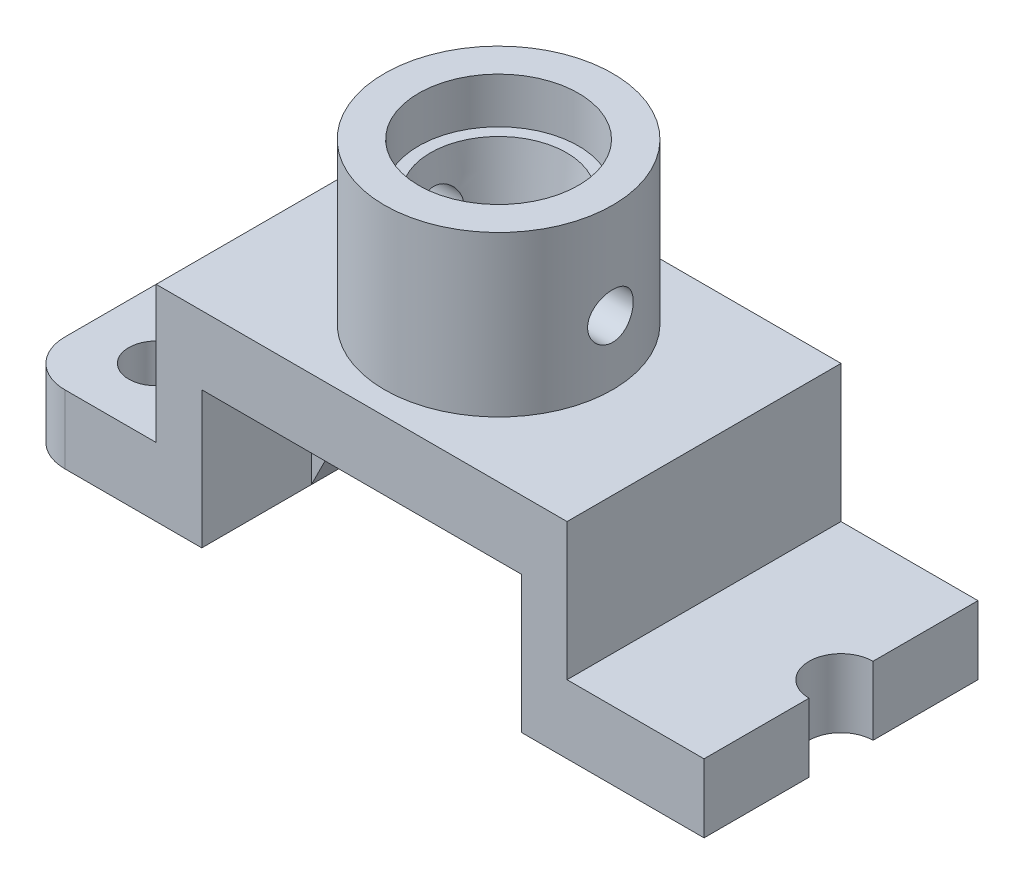
from build123d import *

# Parameters (mm, degrees)
SKETCH1_R           = 25
BOSS_EXTRUDE1_DEPTH = 35
SKETCH2_R           = 17.5
CUT_EXTRUDE1_DEPTH  = 10
SKETCH7_W           = 90
SKETCH7_H           = 60
BOSS_EXTRUDE3_DEPTH = 15
SKETCH8_R           = 10
CUT_EXTRUDE4_DEPTH  = 40
CUT_EXTRUDE4_DRAFT  = 7
SKETCH9_W           = 10
SKETCH9_H           = 60
BOSS_EXTRUDE4_DEPTH = 30
SKETCH11_R          = 5
CUT_EXTRUDE5_DEPTH  = 35
SKETCH12_W          = 60
SKETCH12_H          = 15
BOSS_EXTRUDE5_DEPTH = 30
RIB1_START          = -6
RIB1_DEPTH          = 12
SKETCH16_R          = 6
CUT_EXTRUDE6_DEPTH  = 30
FILLET1_R           = 10
SKETCH17_R          = 7
CUT_EXTRUDE7_DEPTH  = 30


# Read off the part's stored shape, not the designer's step: Rib1
with BuildPart() as part:
    # Sketch1 → Boss-Extrude1 (new body)
    with BuildSketch(Plane(origin=(0, 0, 0), x_dir=(1, 0, 0), z_dir=(0, 1, 0))):
        with Locations(Location((0, 0, 0), (0, 0, 270))):
            Circle(SKETCH1_R)
    extrude(amount=BOSS_EXTRUDE1_DEPTH)

    # Sketch2 → Cut-Extrude1 (cut)
    with BuildSketch(Plane(origin=(0, 35, 0), x_dir=(1, 0, 0), z_dir=(0, 1, 0))):
        with Locations(Location((0, 0, 0), (0, 0, 270))):
            Circle(SKETCH2_R)
    extrude(amount=-CUT_EXTRUDE1_DEPTH, mode=Mode.SUBTRACT)

    # Sketch7 → Boss-Extrude3 (add)
    with BuildSketch(Plane.XZ):
        Rectangle(SKETCH7_W, SKETCH7_H)
    extrude(amount=BOSS_EXTRUDE3_DEPTH)


with BuildPart() as cut_extrude4_tool:
    # Sketch8 → Cut-Extrude4 (with draft: the straight prism first)
    with BuildSketch(Plane.XZ.offset(15)):
        Circle(SKETCH8_R)
    extrude(amount=-CUT_EXTRUDE4_DEPTH)
    # Cut-Extrude4: the draft: its side faces are tilted about the plane it starts from
    cut_extrude4_sides = [cut_extrude4_tool.faces().sort_by_distance(p)[0] for p in [
        (-10, 5, 0),
    ]]
    draft(cut_extrude4_sides, Plane.XZ.offset(15), CUT_EXTRUDE4_DRAFT)


with BuildPart() as part_1:
    add(part.part)

    # Cut-Extrude4: cut by cut_extrude4_tool
    add(cut_extrude4_tool.part, mode=Mode.SUBTRACT)

    # Sketch9 → Boss-Extrude4 (add)
    with BuildSketch(Plane.XZ.offset(15)):
        with Locations((-40, 0)):
            Rectangle(SKETCH9_W, SKETCH9_H)
        with Locations((40, 0)):
            Rectangle(SKETCH9_W, SKETCH9_H)
    extrude(amount=BOSS_EXTRUDE4_DEPTH)

    # Sketch11 → Cut-Extrude5 (cut, symmetric)
    with BuildSketch(Plane(origin=(0, 0, 0), x_dir=(0, 0, -1), z_dir=(1, 0, 0))):
        with Locations((0, 14)):
            Circle(SKETCH11_R)
    extrude(amount=CUT_EXTRUDE5_DEPTH, both=True, mode=Mode.SUBTRACT)

    # Sketch12 → Boss-Extrude5 (add)
    with BuildSketch(Plane(origin=(45, 0, 0), x_dir=(0, 0, -1), z_dir=(1, 0, 0))):
        with Locations((0, -37.5)):
            Rectangle(SKETCH12_W, SKETCH12_H)
    boss_extrude5 = extrude(amount=BOSS_EXTRUDE5_DEPTH)

    # Mirror1: Boss-Extrude5 across plane
    add(boss_extrude5.mirror(Plane(origin=(0, 0, 0), x_dir=(0, 0, 1), z_dir=(1, 0, 0))))

    # Rib1 outline → Rib1 (add)
    with BuildSketch(Plane.XY.offset(RIB1_START)):
        Polygon((-35, -15), (-35, -45), (-20, -15), align=None)
    rib1 = extrude(amount=RIB1_DEPTH)

    # Mirror2: Rib1 across plane
    add(rib1.mirror(Plane(origin=(0, 0, 0), x_dir=(0, 0, 1), z_dir=(1, 0, 0))))

    # Sketch16 → Cut-Extrude6 (cut)
    with BuildSketch(Plane(origin=(0, -30, 0), x_dir=(1, 0, 0), z_dir=(0, 1, 0))):
        with Locations(Location((-60, -15, 0), (0, 0, 270))):
            Circle(SKETCH16_R)
        with Locations(Location((-60, 15, 0), (0, 0, 90))):
            Circle(SKETCH16_R)
    extrude(amount=-CUT_EXTRUDE6_DEPTH, mode=Mode.SUBTRACT)

    # Fillet1
    fillet1_edges = [part_1.edges().sort_by_distance(p)[0] for p in [
        (-75, -37.5, 30),
        (-75, -37.5, -30),
    ]]
    fillet(fillet1_edges, radius=FILLET1_R)

    # Sketch17 → Cut-Extrude7 (cut)
    with BuildSketch(Plane(origin=(0, -30, 0), x_dir=(1, 0, 0), z_dir=(0, 1, 0))):
        with Locations((75, 0)):
            Circle(SKETCH17_R)
    extrude(amount=-CUT_EXTRUDE7_DEPTH, mode=Mode.SUBTRACT)


solid = part_1.part
